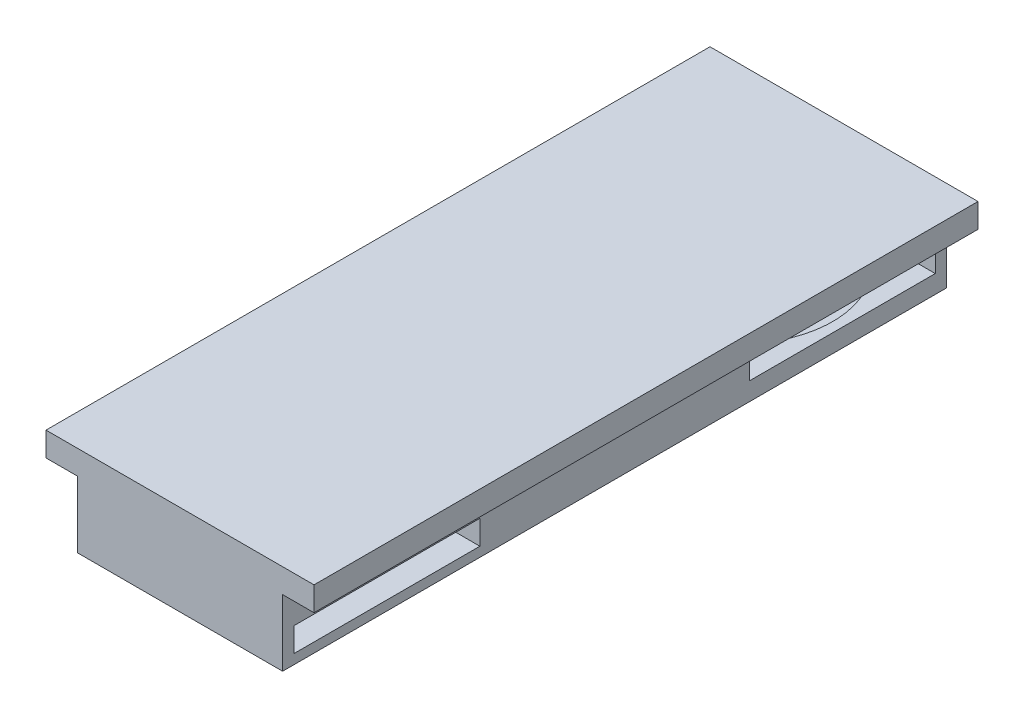
from build123d import *

# Parameters (mm, degrees)
BOSS_EXTRUDE1_DEPTH = 55
SKETCH3_R           = 7.7
CUT_EXTRUDE1_DEPTH  = 2.8
SKETCH4_R           = 7.7
SKETCH4_R_2         = 5.5
BOSS_EXTRUDE2_DEPTH = 0.8
SKETCH5_W           = 15.4
SKETCH5_H           = 2
CUT_EXTRUDE2_DEPTH  = 8.5


with BuildPart() as part:
    # Sketch2 → Boss-Extrude1 (new body)
    with BuildSketch(Plane.XY):
        Polygon((2.6, -2.280794077), (19.6, -2.280794077), (19.6, 3.219205923), (22.2, 3.219205923), (22.2, 5.219205923), (0, 5.219205923), (0, 3.219205923), (2.6, 3.219205923), align=None)
    extrude(amount=-BOSS_EXTRUDE1_DEPTH)

    # Sketch3 → Cut-Extrude1 (cut)
    with BuildSketch(Plane.XZ.offset(2.280794077)):
        with Locations((11.1, -8.64)):
            Circle(SKETCH3_R)
        with Locations((11.1, -46.36)):
            Circle(SKETCH3_R)
    extrude(amount=-CUT_EXTRUDE1_DEPTH, mode=Mode.SUBTRACT)

    # Sketch4 → Boss-Extrude2 (add)
    # profile 1 of 2: a face of its own
    with BuildSketch(Plane.XZ.offset(2.280794077)):
        with Locations((11.1, -8.64)):
            Circle(SKETCH4_R)
        with Locations((11.1, -8.64)):
            Circle(SKETCH4_R_2, mode=Mode.SUBTRACT)
    # profile 2 of 2: a face of its own
    with BuildSketch(Plane.XZ.offset(2.280794077)):
        with Locations((11.1, -46.36)):
            Circle(SKETCH4_R)
        with Locations((11.1, -46.36)):
            Circle(SKETCH4_R_2, mode=Mode.SUBTRACT)
    extrude(amount=-BOSS_EXTRUDE2_DEPTH)

    # Sketch5 → Cut-Extrude2 (cut)
    with BuildSketch(Plane(origin=(19.6, 0, 0), x_dir=(0, 0, -1), z_dir=(1, 0, 0))):
        with Locations((8.64, -0.480794077)):
            Rectangle(SKETCH5_W, SKETCH5_H)
        with Locations((46.36, 0.219205923)):
            Rectangle(SKETCH5_W, SKETCH5_H)
    extrude(amount=-CUT_EXTRUDE2_DEPTH, mode=Mode.SUBTRACT)


solid = part.part
